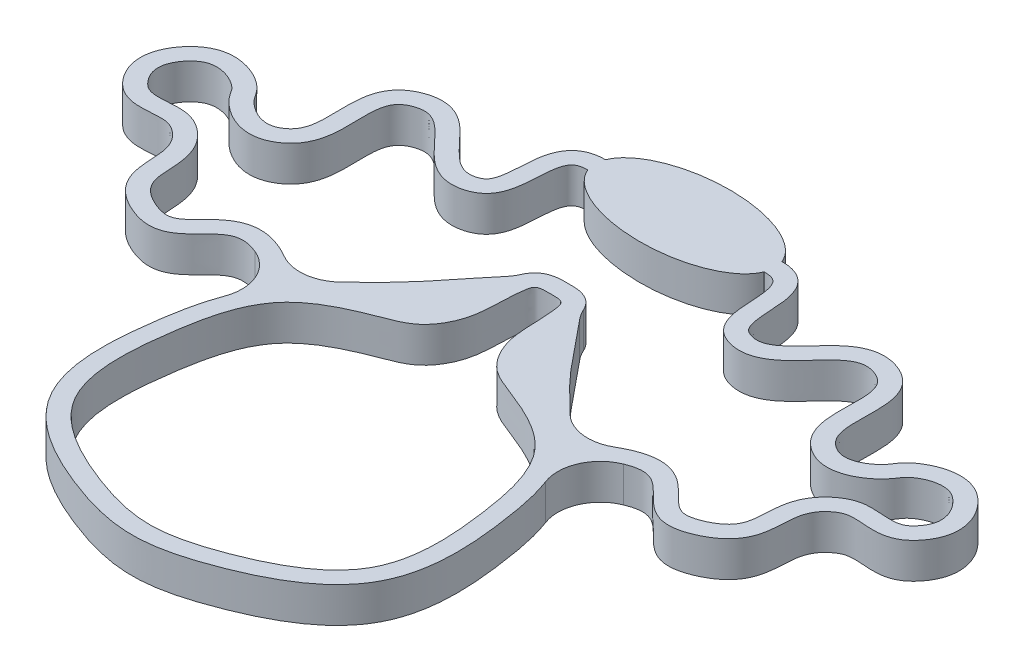
from build123d import *
from build123d.topology import SkipClean

# Parameters (mm, degrees)
BOSS_EXTRUDE1_DEPTH = 10
BOSS_EXTRUDE2_DEPTH = 10
BOSS_EXTRUDE3_REACH = 176.837
SKETCH5_W           = 5
SKETCH5_H           = 10
SKETCH6_RX          = 25.4
SKETCH6_RY          = 12.7
BOSS_EXTRUDE4_DEPTH = 10
CUT_EXTRUDE1_DEPTH  = 10
FILLET1_R           = 12


# Read off the part's stored shape, not the designer's step: Boss-Extrude1, Cut-Extrude1
with BuildPart() as part:
    # Boss-Extrude1 outline → Boss-Extrude1 (new body)
    with BuildSketch(Plane(origin=(0, 0, 0), x_dir=(1, 0, 0), z_dir=(0, 1, 0))):
        with BuildLine():
            add(Edge.make_bspline(
                [(0, 68), (-0.229955016, 68), (-0.689865049, 68.004974728), (-1.591414553, 68.002520989), (-2.663266621, 67.942332713), (-3.975675477, 67.733039222), (-5.328232552, 67.264665196), (-6.494121542, 66.549259145), (-7.346603188, 65.813842008), (-8.071785617, 64.907860236), (-8.702261378, 63.789000687), (-9.114098701, 62.590139977), (-9.346552866, 61.453066474), (-9.466907202, 60.596563457), (-9.560505535, 59.844888938), (-9.667772758, 58.831893117), (-9.766560612, 57.615782215), (-9.845951195, 56.216546964), (-9.90010575, 54.884121927), (-9.956888501, 53.194703593), (-10.030517689, 51.246803133), (-10.206000698, 49.158632524), (-10.524781985, 47.290194827), (-11.042323658, 45.551143123), (-11.8274076, 43.808085659), (-12.810187918, 42.261131322), (-13.738158049, 41.226169627), (-14.474995423, 40.606305144), (-15.343997305, 40.00496245), (-16.706020449, 39.2810116), (-18.761879479, 38.43451401), (-21.209735443, 37.516956832), (-23.750098329, 36.499006083), (-27.137875042, 35.028743538), (-31.346117134, 32.908554215), (-35.331632412, 30.249788348), (-38.25092656, 27.686652161), (-40.938574749, 24.766384761), (-43.57436943, 20.702748431), (-45.80484171, 15.458780742), (-47.348387511, 10.010298069), (-48.419992465, 4.454868396), (-49.217209103, -1.048797751), (-49.856507687, -6.67454438), (-50.167942636, -12.36440955), (-50.005406991, -18.04347673), (-49.19091454, -23.646379545), (-47.793096305, -28.178380739), (-46.133686884, -31.642292326), (-44.075306846, -34.949636813), (-40.934218174, -38.562379143), (-36.531759568, -42.206534709), (-31.702967125, -45.273678326), (-26.614712032, -47.873585483), (-21.421784466, -50.08078529), (-16.288403945, -51.989197765), (-11.013101748, -53.596173502), (-5.608553423, -54.70769409), (0, -55.146152955), (5.608553423, -54.70769409), (11.013101748, -53.596173502), (16.288403945, -51.989197765), (21.421784466, -50.08078529), (26.614712032, -47.873585483), (31.702967125, -45.273678326), (36.531759568, -42.206534709), (40.934218174, -38.562379143), (44.075306846, -34.949636813), (46.133686884, -31.642292326), (47.793096305, -28.178380739), (49.19091454, -23.646379545), (50.005406991, -18.04347673), (50.167942636, -12.36440955), (49.856507687, -6.67454438), (49.217209103, -1.048797751), (48.419992465, 4.454868396), (47.348387511, 10.010298069), (45.80484171, 15.458780742), (43.57436943, 20.702748431), (40.938574749, 24.766384761), (38.25092656, 27.686652161), (35.331632412, 30.249788348), (31.346117134, 32.908554215), (27.137875042, 35.028743538), (23.750098329, 36.499006083), (21.209735443, 37.516956832), (18.761879479, 38.43451401), (16.706020449, 39.2810116), (15.343997305, 40.00496245), (14.474995423, 40.606305144), (13.738158049, 41.226169627), (12.810187918, 42.261131322), (11.8274076, 43.808085659), (11.042323658, 45.551143123), (10.524781985, 47.290194827), (10.206000698, 49.158632524), (10.030517689, 51.246803133), (9.956888501, 53.194703593), (9.90010575, 54.884121927), (9.845951195, 56.216546964), (9.766560612, 57.615782215), (9.667772758, 58.831893117), (9.560505535, 59.844888938), (9.466907202, 60.596563457), (9.346552866, 61.453066474), (9.114098701, 62.590139977), (8.702261378, 63.789000687), (8.071785617, 64.907860236), (7.346603188, 65.813842008), (6.494121542, 66.549259145), (5.328232552, 67.264665196), (3.975675477, 67.733039222), (2.663266621, 67.942332713), (1.591414553, 68.002520989), (0.689865049, 68.004974728), (0.229955016, 68), (0, 68)],
                knots=[0, 0, 0, 0, 0.001953125, 0.00390625, 0.005859375, 0.0078125, 0.009765625, 0.010742188, 0.01171875, 0.012695312, 0.013671875, 0.015625, 0.017578125, 0.01953125, 0.021484375, 0.0234375, 0.02734375, 0.03125, 0.03515625, 0.0390625, 0.046875, 0.0546875, 0.0625, 0.0703125, 0.078125, 0.0859375, 0.09375, 0.09765625, 0.1015625, 0.109375, 0.1171875, 0.125, 0.1328125, 0.140625, 0.15625, 0.171875, 0.1796875, 0.1875, 0.203125, 0.21875, 0.234375, 0.25, 0.265625, 0.28125, 0.296875, 0.3125, 0.328125, 0.34375, 0.3515625, 0.359375, 0.375, 0.390625, 0.40625, 0.421875, 0.4375, 0.453125, 0.46875, 0.484375, 0.5, 0.515625, 0.53125, 0.546875, 0.5625, 0.578125, 0.59375, 0.609375, 0.625, 0.640625, 0.6484375, 0.65625, 0.671875, 0.6875, 0.703125, 0.71875, 0.734375, 0.75, 0.765625, 0.78125, 0.796875, 0.8125, 0.8203125, 0.828125, 0.84375, 0.859375, 0.8671875, 0.875, 0.8828125, 0.890625, 0.8984375, 0.90234375, 0.90625, 0.9140625, 0.921875, 0.9296875, 0.9375, 0.9453125, 0.953125, 0.9609375, 0.96484375, 0.96875, 0.97265625, 0.9765625, 0.978515625, 0.98046875, 0.982421875, 0.984375, 0.986328125, 0.987304688, 0.98828125, 0.989257812, 0.990234375, 0.9921875, 0.994140625, 0.99609375, 0.998046875, 1, 1, 1, 1], degree=3))
        make_face()
        with BuildLine():
            add(Edge.make_bspline(
                [(0, 63), (-1.52652089, 63), (-3.986940007, 63.159481514), (-5.346196174, 55.274620078), (-4.149353373, 46.810195668), (-10.242716569, 36.151969235), (-22.370270069, 31.936434422), (-39.510854167, 23.948082796), (-45.007896798, -1.712817306), (-46.722154478, -32.350862611), (-21.102343681, -45.688135745), (0, -51.703869298), (21.102343681, -45.688135745), (46.722154478, -32.350862611), (45.007896798, -1.712817306), (39.510854167, 23.948082796), (22.370270069, 31.936434422), (10.242716569, 36.151969235), (4.149353373, 46.810195668), (5.346196174, 55.274620078), (3.986940007, 63.159481514), (1.52652089, 63), (0, 63)],
                knots=[0, 0, 0, 0, 0.012028603, 0.019387488, 0.066377658, 0.095784615, 0.123665083, 0.184474112, 0.260640782, 0.354546782, 0.442522942, 0.5, 0.557477058, 0.645453218, 0.739359218, 0.815525888, 0.876334917, 0.904215385, 0.933622342, 0.980612512, 0.987971397, 1, 1, 1, 1], degree=3))
        make_face(mode=Mode.SUBTRACT)
    extrude(amount=BOSS_EXTRUDE1_DEPTH)

    # Sketch4 → Boss-Extrude2 (add)
    with BuildSketch(Plane(origin=(0, 0, 0), x_dir=(1, 0, 0), z_dir=(0, 1, 0))):
        with BuildLine():
            Line((25, 98.528473189), (25, 103.528473189))
            add(Edge.make_bspline(
                [(39.280273452, 22.807206451), (39.540497242, 23.040479628), (40.069307476, 23.509843419), (41.087670869, 24.39503951), (42.321082568, 25.432415063), (43.728799056, 26.560876691), (45.514768102, 27.918593123), (47.578036741, 29.348078948), (49.792570042, 30.666821967), (51.752529033, 31.622575442), (54.037690004, 32.464470121), (56.296678785, 32.815169434), (58.291772973, 32.522349553), (60.609911094, 31.453709864), (62.863993034, 29.314236059), (65.324781622, 26.778620512), (67.451197431, 24.932085682), (69.686631057, 23.694406793), (71.801854319, 23.149373865), (74.117916562, 23.00225994), (76.95679035, 23.53585364), (80.169052248, 24.786028729), (82.964895639, 26.384949347), (85.888137035, 28.774824271), (88.136048081, 32.298780809), (88.983578985, 36.549446587), (89.125147682, 40.383830989), (89.365588353, 43.19400065), (89.898580269, 45.180286841), (90.525609432, 46.5780955), (91.465235489, 47.940110502), (92.885506347, 49.351283221), (94.622069112, 50.477308787), (96.220364341, 50.976444537), (98.339151016, 51.060467174), (100.877654022, 50.866481544), (103.723679195, 50.705274451), (106.339347499, 50.964858257), (108.490136406, 51.700467505), (110.07990785, 52.590727339), (111.506372632, 53.793417627), (113.121003443, 55.602325578), (114.649781907, 58.103901748), (115.84055282, 62.17254608), (115.197304487, 66.978497821), (112.987817287, 70.663075399), (110.907120908, 72.92453274), (108.764920949, 74.71284465), (105.815324594, 76.131077973), (102.146063317, 76.521730573), (98.684539008, 75.972088957), (95.556775506, 74.765347188), (93.324011516, 73.380225468), (91.82987865, 72.118399235), (90.841622484, 71.061291297), (90.118043328, 70.009866834), (89.632766452, 69.239404631), (89.166105564, 68.619581134), (88.470178205, 67.873952018), (87.620610831, 67.120780313), (86.315377567, 66.156696611), (84.450458215, 65.150477325), (82.522417609, 64.648950803), (81.051314114, 64.626038697), (80.00447102, 64.798659034), (78.904621559, 65.211717567), (77.815550782, 65.848012472), (76.865213753, 66.635714613), (75.916344046, 67.750930074), (75.111699058, 69.410489967), (74.608967967, 71.973577283), (74.492348654, 74.987637545), (74.574768217, 78.273062647), (74.616331496, 81.689491508), (74.33333175, 85.141753053), (73.355404879, 88.569494923), (71.542446002, 91.19520065), (69.411569663, 92.848204452), (67.034555159, 94.11508731), (64.397676802, 94.873883059), (61.662464274, 94.967980008), (59.067173807, 94.548524737), (56.218779954, 93.251540251), (53.386143682, 91.025712479), (50.89957423, 88.501480969), (48.598243925, 85.956578591), (46.387698276, 83.670082457), (44.233645082, 81.921464104), (42.199525684, 80.930170957), (40.50693809, 80.721456324), (38.958071084, 80.968037181), (37.909999173, 81.352746609), (37.11688206, 81.86873264), (36.615722999, 82.434118274), (36.142456376, 83.327617037), (35.647415583, 84.96181936), (35.318585141, 87.705455874), (35.153777965, 91.550170831), (34.828694586, 94.880652528), (34.138829361, 97.502183402), (33.281291076, 99.413042742), (31.936006754, 101.168293906), (30.040512437, 102.545323494), (28.096794455, 103.223545611), (26.392484735, 103.485746429), (25.457793743, 103.528473189), (25, 103.528473189)],
                knots=[0, 0, 0, 0, 0.000976562, 0.001953125, 0.00390625, 0.005859375, 0.0078125, 0.01171875, 0.015625, 0.01953125, 0.0234375, 0.03125, 0.0390625, 0.046875, 0.0625, 0.0703125, 0.078125, 0.0859375, 0.08984375, 0.09375, 0.1015625, 0.109375, 0.1171875, 0.125, 0.140625, 0.15625, 0.171875, 0.1875, 0.1953125, 0.203125, 0.2109375, 0.21875, 0.2265625, 0.234375, 0.2421875, 0.25, 0.2578125, 0.265625, 0.26953125, 0.2734375, 0.27734375, 0.28125, 0.2890625, 0.296875, 0.3125, 0.328125, 0.3359375, 0.34375, 0.359375, 0.375, 0.390625, 0.40625, 0.421875, 0.4296875, 0.4375, 0.4453125, 0.453125, 0.4609375, 0.46875, 0.4765625, 0.484375, 0.5, 0.515625, 0.5234375, 0.53125, 0.5390625, 0.546875, 0.5546875, 0.5625, 0.578125, 0.59375, 0.609375, 0.625, 0.640625, 0.65625, 0.671875, 0.6875, 0.6953125, 0.703125, 0.71875, 0.7265625, 0.734375, 0.75, 0.765625, 0.78125, 0.796875, 0.8125, 0.828125, 0.84375, 0.859375, 0.8671875, 0.875, 0.8828125, 0.890625, 0.8984375, 0.90625, 0.921875, 0.9375, 0.953125, 0.9609375, 0.96875, 0.9765625, 0.984375, 0.9921875, 0.99609375, 1, 1, 1, 1], degree=3))
            Line((39.280273452, 22.807206451), (35.942793549, 26.530273452))
            add(Edge.make_bspline(
                [(35.942793549, 26.530273452), (36.480411154, 27.012211584), (37.587725238, 27.985269166), (39.142550797, 29.292491372), (40.648796847, 30.500373795), (42.576541654, 31.965972213), (44.851216403, 33.543644467), (47.385983827, 35.055969237), (49.752473836, 36.214017112), (52.715555819, 37.313522522), (56.123381212, 37.894884608), (59.76016467, 37.390512941), (62.750044902, 35.962678449), (65.120376172, 34.093666638), (67.086506173, 32.137201171), (68.822031902, 30.357476208), (70.421480612, 29.000465879), (71.629018254, 28.361152557), (72.599477451, 28.116799525), (73.64379084, 28.039028763), (75.519043963, 28.348154869), (78.011213831, 29.315518456), (80.169178409, 30.556284666), (81.625794359, 31.768320808), (82.601806488, 32.96775019), (83.459452682, 34.603624076), (83.982486016, 36.970602423), (84.13327561, 40.515185016), (84.435524755, 44.596410705), (85.645793722, 48.333598622), (87.642254221, 51.207667756), (89.706184644, 53.243815993), (91.885234163, 54.694783512), (93.932494984, 55.523186675), (96.071973265, 56.001222873), (98.574443936, 56.060244839), (101.31022046, 55.845638802), (103.724175433, 55.724375569), (105.357300329, 55.914051059), (106.4488041, 56.296447628), (107.19306877, 56.708915864), (107.986096066, 57.367802328), (108.785816066, 58.256730427), (109.468195681, 59.236590084), (110.124570307, 60.48382011), (110.539119141, 61.927534773), (110.568081527, 63.5599035), (110.206003423, 65.157255677), (109.503216745, 66.696540872), (108.544616115, 68.103738148), (107.44053852, 69.302170904), (106.359768758, 70.194329103), (105.39196185, 70.765799616), (104.102086897, 71.25644809), (102.317713225, 71.466890102), (100.015788909, 71.115462757), (97.788118936, 70.259141251), (96.219337923, 69.281863125), (95.25813652, 68.461763617), (94.746146789, 67.910242776), (94.35558235, 67.353501317), (93.80673232, 66.47605832), (92.966849354, 65.352229443), (91.951675939, 64.277557466), (90.766820076, 63.225619576), (88.97598914, 61.904916321), (86.370883087, 60.484838921), (83.329125016, 59.663338478), (80.706230251, 59.607562649), (78.667916871, 59.947029446), (76.716564393, 60.689937993), (74.943702282, 61.730854605), (73.364985352, 63.029458574), (71.616771757, 65.074314571), (70.272371738, 67.947700061), (69.397949885, 72.688570631), (69.568973227, 77.372583906), (69.61124965, 81.587844979), (69.367537063, 84.337281101), (68.825069732, 86.117176583), (68.171445012, 87.230948289), (67.550436057, 87.952026159), (66.711706358, 88.61012177), (65.228625636, 89.41522645), (63.015127061, 90.023824656), (60.952188512, 89.874077389), (58.928583472, 88.992397292), (56.782328725, 87.341214034), (54.578834339, 85.114534934), (52.295208919, 82.589939081), (49.845488143, 80.046811308), (47.080103977, 77.761280104), (44.315200894, 76.358376473), (41.779580862, 75.812106262), (39.749955996, 75.767862409), (37.714939145, 76.097297308), (35.737449874, 76.80740647), (33.885314515, 77.96372834), (32.385310891, 79.656485263), (31.451295604, 81.527775183), (30.688105051, 84.119375444), (30.327395774, 87.428474754), (30.160899155, 91.298952555), (29.8624201, 94.12461988), (29.387823056, 95.874056039), (28.925047447, 96.867014235), (28.38853819, 97.543432215), (27.837672327, 97.94835261), (27.219134255, 98.219056135), (26.635983679, 98.385146459), (26.028515455, 98.480288217), (25.471278063, 98.521196793), (25.153903363, 98.528473189), (25, 98.528473189)],
                knots=[0, 0, 0, 0, 0.001953125, 0.00390625, 0.005859375, 0.0078125, 0.01171875, 0.015625, 0.01953125, 0.0234375, 0.03125, 0.0390625, 0.046875, 0.0546875, 0.0625, 0.0703125, 0.078125, 0.0859375, 0.08984375, 0.09375, 0.1015625, 0.109375, 0.1171875, 0.125, 0.1328125, 0.140625, 0.15625, 0.171875, 0.1875, 0.203125, 0.2109375, 0.21875, 0.2265625, 0.23046875, 0.234375, 0.2421875, 0.25, 0.2578125, 0.265625, 0.26953125, 0.2734375, 0.27734375, 0.28125, 0.28515625, 0.2890625, 0.296875, 0.3046875, 0.3125, 0.3203125, 0.328125, 0.3359375, 0.34375, 0.3515625, 0.359375, 0.375, 0.390625, 0.40625, 0.421875, 0.4296875, 0.4375, 0.4453125, 0.453125, 0.4609375, 0.46875, 0.4765625, 0.484375, 0.5, 0.515625, 0.5234375, 0.53125, 0.5390625, 0.546875, 0.5546875, 0.5625, 0.578125, 0.59375, 0.625, 0.640625, 0.65625, 0.671875, 0.6796875, 0.6875, 0.6953125, 0.703125, 0.71875, 0.734375, 0.75, 0.765625, 0.78125, 0.796875, 0.8125, 0.828125, 0.84375, 0.8515625, 0.859375, 0.8671875, 0.875, 0.8828125, 0.890625, 0.8984375, 0.90625, 0.921875, 0.9375, 0.953125, 0.9609375, 0.96875, 0.9765625, 0.984375, 0.98828125, 0.9921875, 0.99609375, 0.998046875, 1, 1, 1, 1], degree=3))
        make_face()
    boss_extrude2 = extrude(amount=BOSS_EXTRUDE2_DEPTH)

    # Mirror1: Boss-Extrude2 across plane
    with SkipClean():  # the faces are left unmerged after this step: merging them gives an invalid solid
        add(boss_extrude2.mirror(Plane(origin=(0, 0, 0), x_dir=(0, 0, 1), z_dir=(1, 0, 0))))
    add(part.part.scale(1), mode=Mode.REPLACE)  # the faces are merged on a copy

    # Sketch5 → Boss-Extrude3 (add, up to next)
    with BuildSketch(Plane(origin=(-25, 0, 0), x_dir=(0, 0, -1), z_dir=(1, 0, 0)), mode=Mode.PRIVATE) as boss_extrude3_sk1:
        with Locations((101.028473189, 5)):
            Rectangle(SKETCH5_W, SKETCH5_H)
    boss_extrude3_tool1 = extrude(boss_extrude3_sk1.sketch, amount=BOSS_EXTRUDE3_REACH, mode=Mode.PRIVATE) - part.part
    add(boss_extrude3_tool1.solids().sort_by_distance((-25, 5, -101.028473))[0])

    # Sketch6 → Boss-Extrude4 (add)
    with BuildSketch(Plane(origin=(0, 0, 0), x_dir=(1, 0, 0), z_dir=(0, 1, 0))):
        with Locations((0, 101.028473189)):
            Ellipse(SKETCH6_RX, SKETCH6_RY)
        with BuildLine():
            add(Edge.make_bspline(
                [(-41.071615172, 24.375831098), (-40.808288357, 29.591021177), (-19.918389257, 44.979141392), (0, 80.652886558), (19.918389257, 44.979141392), (69.414690824, 8.518695361), (-41.87227804, 8.518695361), (-41.071615172, 24.375831098)],
                knots=[0, 0, 0, 0, 0.133666052, 0.296789696, 0.459913341, 0.593579392, 1, 1, 1, 1], degree=3))
        make_face()
    extrude(amount=BOSS_EXTRUDE4_DEPTH)

    # Cut-Extrude1 outline → Cut-Extrude1 (cut)
    with BuildSketch(Plane(origin=(0, 0, 0), x_dir=(1, 0, 0), z_dir=(0, 1, 0))):
        with BuildLine():
            add(Edge.make_bspline(
                [(38.284681232, 19.559646602), (37.541925284, 20.785488281), (33.040169176, 26.963738894), (22.370270069, 31.936434422), (10.242716569, 36.151969235), (4.149353373, 46.810195668), (5.346196174, 55.274620078), (3.986940007, 63.159481514), (0, 62.901052686), (-3.986940007, 63.159481514), (-5.346196174, 55.274620078), (-4.149353373, 46.810195668), (-10.242716569, 36.151969235), (-22.370270069, 31.936434422), (-33.040169176, 26.963738894), (-37.541925284, 20.785488281), (-38.284681232, 19.559646602)],
                knots=[0.801593522, 0.801593522, 0.801593522, 0.801593522, 0.815525888, 0.876334917, 0.904215385, 0.933622342, 0.980612512, 0.987971397, 1, 1.012028603, 1.019387488, 1.066377658, 1.095784615, 1.123665083, 1.184474112, 1.198406478, 1.198406478, 1.198406478, 1.198406478], degree=3))
            add(Edge.make_bspline(
                [(-38.284681232, 19.559646602), (-25.69702275, 10.124090193), (25.697022748, 10.124090192), (38.284681232, 19.559646602)],
                knots=[0.046456853, 0.046456853, 0.046456853, 0.046456853, 0.359963755, 0.359963755, 0.359963755, 0.359963755], degree=3))
        make_face()
    extrude(amount=CUT_EXTRUDE1_DEPTH, mode=Mode.SUBTRACT)

    # Fillet1
    fillet1_edges = [part.edges().sort_by_distance(p)[0] for p in [
        (9.150957565, 5, -62.33804186),
        (-9.150957565, 5, -62.33804186),
        (-41.071615172, 5, -24.375831098),
        (41.071615172, 5, -24.375831098),
        (38.956152632, 5, -29.12903151),
        (-38.956152632, 5, -29.12903151),
    ]]
    fillet(fillet1_edges, radius=FILLET1_R)


solid = part.part
